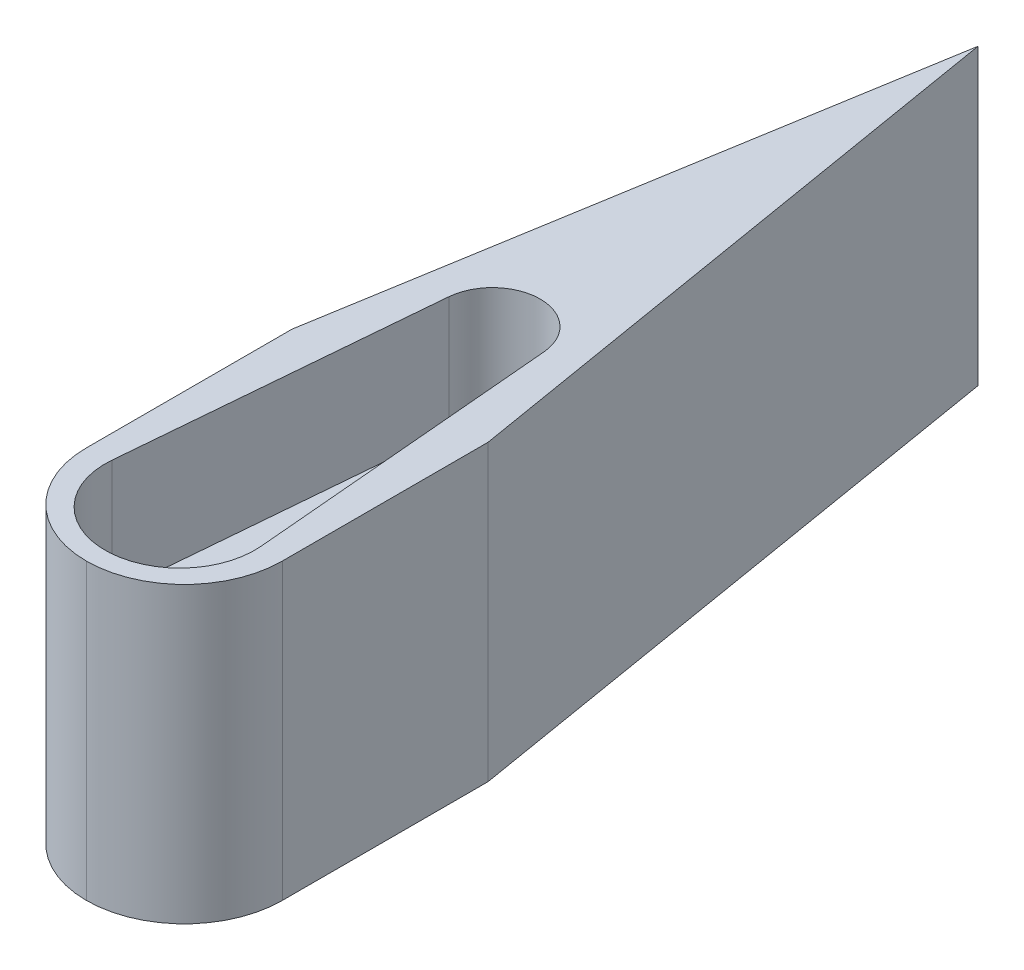
from build123d import *

# Parameters (mm, degrees)
BOSS_EXTRUDE1_DEPTH = 19.05
FILLET1_R           = 6.35
CUT_EXTRUDE1_DEPTH  = 7.5


with BuildPart() as part:
    # Sketch1 → Boss-Extrude1 (new body)
    with BuildSketch(Plane(origin=(0, 0, 0), x_dir=(1, 0, 0), z_dir=(0, 1, 0))):
        Polygon((0, 38.1), (-6.35, 0), (-6.35, -19.685), (6.35, -19.685), (6.35, 0), align=None)
    extrude(amount=BOSS_EXTRUDE1_DEPTH)

    # Fillet1
    fillet1_edges = [part.edges().sort_by_distance(p)[0] for p in [
        (-6.35, 9.525, 19.685),
        (6.35, 9.525, 19.685),
    ]]
    fillet(fillet1_edges, radius=FILLET1_R - 0.0001)  # a hair under: the kernel refuses the full size

    # Sketch4 → Cut-Extrude1 (cut)
    with BuildSketch(Plane(origin=(0, 19.05, 0), x_dir=(1, 0, 0), z_dir=(0, 1, 0))):
        with BuildLine():
            Line((-4.831855252, -13.202514523), (-3.088402326, 6.896250909))
            ThreePointArc((-3.088402326, 6.896250909), (0, 9.728349675), (3.088402326, 6.896250909))
            Line((3.088402326, 6.896250909), (4.831855252, -13.202514523))
            ThreePointArc((4.831855252, -13.202514523), (0, -18.471650325), (-4.831855252, -13.202514523))
        make_face()
    extrude(amount=-CUT_EXTRUDE1_DEPTH, mode=Mode.SUBTRACT)


solid = part.part
